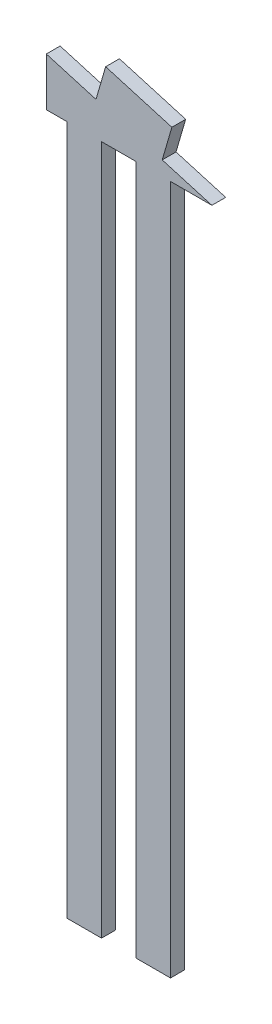
from build123d import *

# Parameters (mm, degrees)
BOSS_EXTRUDE1_DEPTH = 2


with BuildPart() as part:
    # Sketch1 → Boss-Extrude1 (new body)
    with BuildSketch(Plane.XY):
        Polygon((0, 7), (0, 0), (3, 0), (3, -100), (8, -100), (8, 0), (13, 0), (13, -100), (18, -100), (18, 0), (24, 0), (16.8, 2.1), (18.2, 6.9), (8.6, 9.7), (7.2, 4.9), align=None)
    extrude(amount=BOSS_EXTRUDE1_DEPTH)


solid = part.part
